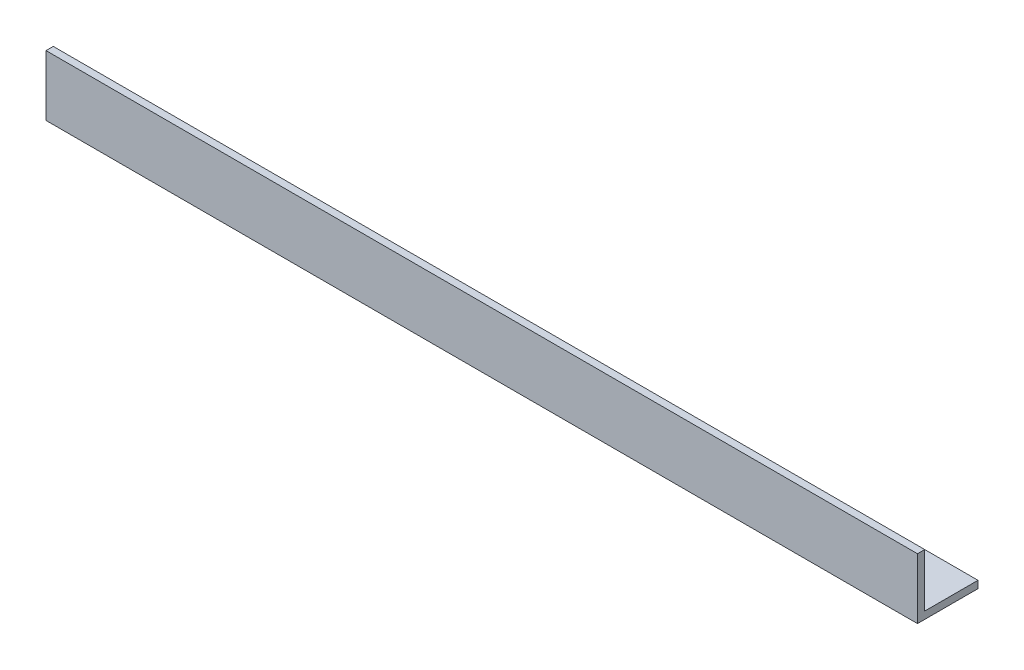
from build123d import *

# Parameters (mm, degrees)
EXTRUDE_1_DEPTH = 360


with BuildPart() as part:
    # Эскиз1 → Вытянуть-Тонкостенный1 (new body)
    with BuildSketch(Plane(origin=(0, 0, 0), x_dir=(0, 0, -1), z_dir=(1, 0, 0))):
        Polygon((0, 25), (0, 0), (25, 0), (25, 3), (3, 3), (3, 25), align=None)
    extrude(amount=EXTRUDE_1_DEPTH)


solid = part.part
